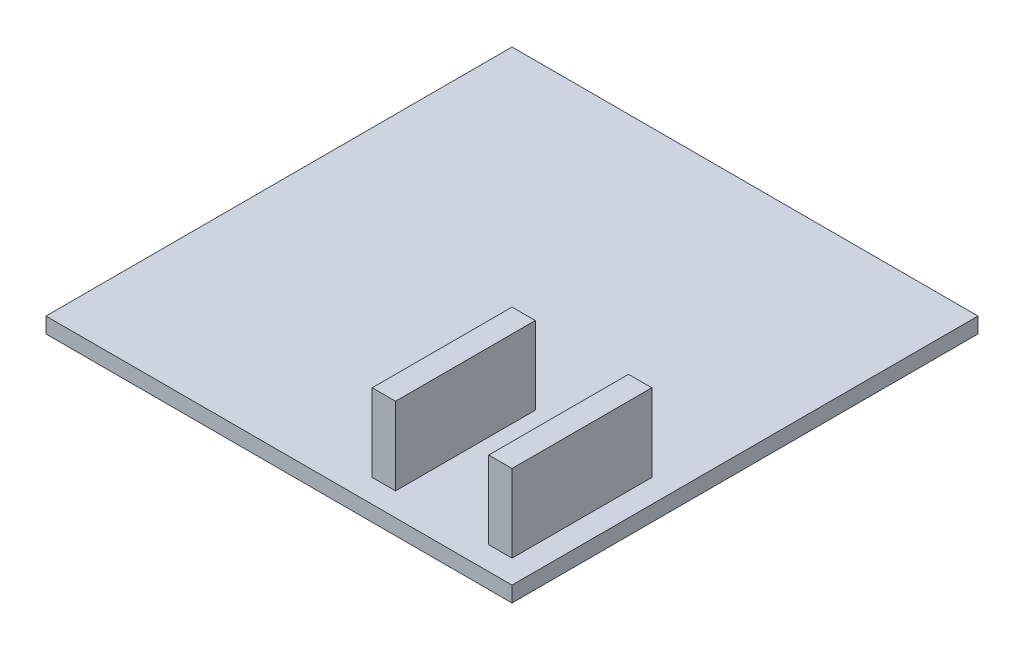
from build123d import *

# Parameters (mm, degrees)
SKETCH3_W           = 300
SKETCH3_H           = 300
BOSS_EXTRUDE1_DEPTH = 10
SKETCH4_W           = 15
SKETCH4_H           = 90
BOSS_EXTRUDE2_DEPTH = 50


with BuildPart() as part:
    # Sketch3 → Boss-Extrude1 (new body)
    with BuildSketch(Plane(origin=(0, 0, 0), x_dir=(1, 0, 0), z_dir=(0, 1, 0))):
        Rectangle(SKETCH3_W, SKETCH3_H)
    extrude(amount=BOSS_EXTRUDE1_DEPTH)

    # Sketch4 → Boss-Extrude2 (add)
    with BuildSketch(Plane(origin=(0, 10, 0), x_dir=(1, 0, 0), z_dir=(0, 1, 0))):
        with Locations((127.5, -90)):
            Rectangle(SKETCH4_W, SKETCH4_H)
        with Locations((52.5, -90)):
            Rectangle(SKETCH4_W, SKETCH4_H)
    extrude(amount=BOSS_EXTRUDE2_DEPTH)


solid = part.part
